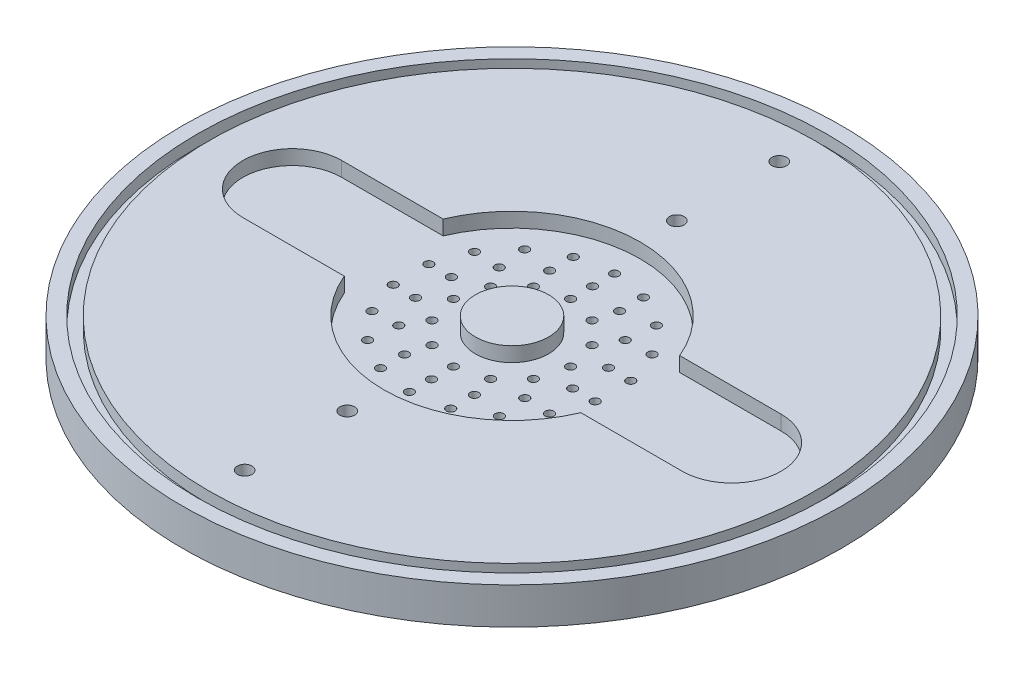
from build123d import *

# Parameters (mm, degrees)
MAIN_SHAPE_PROFILE_W          = 57.15
MAIN_SHAPE_PROFILE_H          = 6.35
O_RINGS_PROFILE_W             = 2.032
O_RINGS_PROFILE_H             = 2.032
INJECTOR_WELL_PROFILE_R       = 6.35
INJECTOR_WELL_DEPTH           = 2.54
DOWEL_HOLES_PROFILE_R         = 1.27
DOWEL_HOLES_DEPTH             = 2.54
INJECTOR_HOLES_R              = 0.7493
CIRCULAR_INJECTOR_HOLES_DEPTH = 81.912057816


with BuildPart() as part:
    # Main Shape Profile → Main Shape (revolve)
    with BuildSketch(Plane.XY):
        with Locations((28.575, 3.175)):
            Rectangle(MAIN_SHAPE_PROFILE_W, MAIN_SHAPE_PROFILE_H)
    revolve(axis=Axis((0, 0, 0), (0, -1, 0)))

    # O Rings Profile → O-Rings Cutout (revolve, cut)
    with BuildSketch(Plane.XY):
        with Locations((53.594, 5.334)):
            Rectangle(O_RINGS_PROFILE_W, O_RINGS_PROFILE_H)
        with Locations((53.594, 1.016)):
            Rectangle(O_RINGS_PROFILE_W, O_RINGS_PROFILE_H)
    revolve(axis=Axis((0, 0, 0), (0, -1, 0)), mode=Mode.SUBTRACT)

    # Injector Well Profile → Injector Well (cut)
    with BuildSketch(Plane(origin=(0, 6.35, 0), x_dir=(1, 0, 0), z_dir=(0, 1, 0))):
        with BuildLine():
            Line((-38.1, 8.57504), (-20.504129194, 8.57504))
            ThreePointArc((-20.504129194, 8.57504), (0, 22.225), (20.504129194, 8.57504))
            Line((20.504129194, 8.57504), (38.1, 8.57504))
            ThreePointArc((38.1, 8.57504), (46.67504, 0), (38.1, -8.57504))
            Line((38.1, -8.57504), (20.504129194, -8.57504))
            ThreePointArc((20.504129194, -8.57504), (0, -22.225), (-20.504129194, -8.57504))
            Line((-20.504129194, -8.57504), (-38.1, -8.57504))
            ThreePointArc((-38.1, -8.57504), (-46.67504, 0), (-38.1, 8.57504))
        make_face()
        Circle(INJECTOR_WELL_PROFILE_R, mode=Mode.SUBTRACT)
    extrude(amount=-INJECTOR_WELL_DEPTH, mode=Mode.SUBTRACT)

    # Dowel Holes Profile → Dowel Holes (cut)
    with BuildSketch(Plane(origin=(0, 6.35, 0), x_dir=(1, 0, 0), z_dir=(0, 1, 0))):
        with Locations((0, 28.575)):
            Circle(DOWEL_HOLES_PROFILE_R)
        with Locations((0, 46.355)):
            Circle(DOWEL_HOLES_PROFILE_R)
        with Locations((0, -46.355)):
            Circle(DOWEL_HOLES_PROFILE_R)
        with Locations((0, -28.575)):
            Circle(DOWEL_HOLES_PROFILE_R)
    extrude(amount=-DOWEL_HOLES_DEPTH, mode=Mode.SUBTRACT)

    # Injector Holes → Circular Injector Holes (cut, through all)
    with BuildSketch(Plane(origin=(0, 3.81, 0), x_dir=(1, 0, 0), z_dir=(0, 1, 0))):
        with Locations((0, -17.78)):
            Circle(INJECTOR_HOLES_R)
        with Locations((0, -13.97)):
            Circle(INJECTOR_HOLES_R)
        with Locations((0, -10.16)):
            Circle(INJECTOR_HOLES_R)
        with Locations((-6.081118148, -16.707734798)):
            Circle(INJECTOR_HOLES_R)
        with Locations((-11.4287637, -13.620270199)):
            Circle(INJECTOR_HOLES_R)
        with Locations((-15.397931679, -8.89)):
            Circle(INJECTOR_HOLES_R)
        with Locations((-17.509881849, -3.087464599)):
            Circle(INJECTOR_HOLES_R)
        with Locations((-17.509881849, 3.087464599)):
            Circle(INJECTOR_HOLES_R)
        with Locations((-15.397931679, 8.89)):
            Circle(INJECTOR_HOLES_R)
        with Locations((-11.4287637, 13.620270199)):
            Circle(INJECTOR_HOLES_R)
        with Locations((-6.081118148, 16.707734798)):
            Circle(INJECTOR_HOLES_R)
        with Locations((0, 17.78)):
            Circle(INJECTOR_HOLES_R)
        with Locations((6.081118148, 16.707734798)):
            Circle(INJECTOR_HOLES_R)
        with Locations((11.4287637, 13.620270199)):
            Circle(INJECTOR_HOLES_R)
        with Locations((15.397931679, 8.89)):
            Circle(INJECTOR_HOLES_R)
        with Locations((17.509881849, 3.087464599)):
            Circle(INJECTOR_HOLES_R)
        with Locations((17.509881849, -3.087464599)):
            Circle(INJECTOR_HOLES_R)
        with Locations((15.397931679, -8.89)):
            Circle(INJECTOR_HOLES_R)
        with Locations((11.4287637, -13.620270199)):
            Circle(INJECTOR_HOLES_R)
        with Locations((-6.061355835, -12.586535085)):
            Circle(INJECTOR_HOLES_R)
        with Locations((-10.92218581, -8.710152532)):
            Circle(INJECTOR_HOLES_R)
        with Locations((-13.619742933, -3.108617447)):
            Circle(INJECTOR_HOLES_R)
        with Locations((-13.619742933, 3.108617447)):
            Circle(INJECTOR_HOLES_R)
        with Locations((-10.92218581, 8.710152532)):
            Circle(INJECTOR_HOLES_R)
        with Locations((-6.061355835, 12.586535085)):
            Circle(INJECTOR_HOLES_R)
        with Locations((0, 13.97)):
            Circle(INJECTOR_HOLES_R)
        with Locations((6.061355835, 12.586535085)):
            Circle(INJECTOR_HOLES_R)
        with Locations((10.92218581, 8.710152532)):
            Circle(INJECTOR_HOLES_R)
        with Locations((13.619742933, 3.108617447)):
            Circle(INJECTOR_HOLES_R)
        with Locations((13.619742933, -3.108617447)):
            Circle(INJECTOR_HOLES_R)
        with Locations((10.92218581, -8.710152532)):
            Circle(INJECTOR_HOLES_R)
        with Locations((-5.08, -8.798818102)):
            Circle(INJECTOR_HOLES_R)
        with Locations((-8.798818102, -5.08)):
            Circle(INJECTOR_HOLES_R)
        with Locations((-10.16, 0)):
            Circle(INJECTOR_HOLES_R)
        with Locations((-8.798818102, 5.08)):
            Circle(INJECTOR_HOLES_R)
        with Locations((-5.08, 8.798818102)):
            Circle(INJECTOR_HOLES_R)
        with Locations((0, 10.16)):
            Circle(INJECTOR_HOLES_R)
        with Locations((5.08, 8.798818102)):
            Circle(INJECTOR_HOLES_R)
        with Locations((8.798818102, 5.08)):
            Circle(INJECTOR_HOLES_R)
        with Locations((10.16, 0)):
            Circle(INJECTOR_HOLES_R)
        with Locations((6.061355835, -12.586535085)):
            Circle(INJECTOR_HOLES_R)
        with Locations((6.081118148, -16.707734798)):
            Circle(INJECTOR_HOLES_R)
        with Locations((8.798818102, -5.08)):
            Circle(INJECTOR_HOLES_R)
        with Locations((5.08, -8.798818102)):
            Circle(INJECTOR_HOLES_R)
    extrude(amount=-CIRCULAR_INJECTOR_HOLES_DEPTH, mode=Mode.SUBTRACT)


solid = part.part
